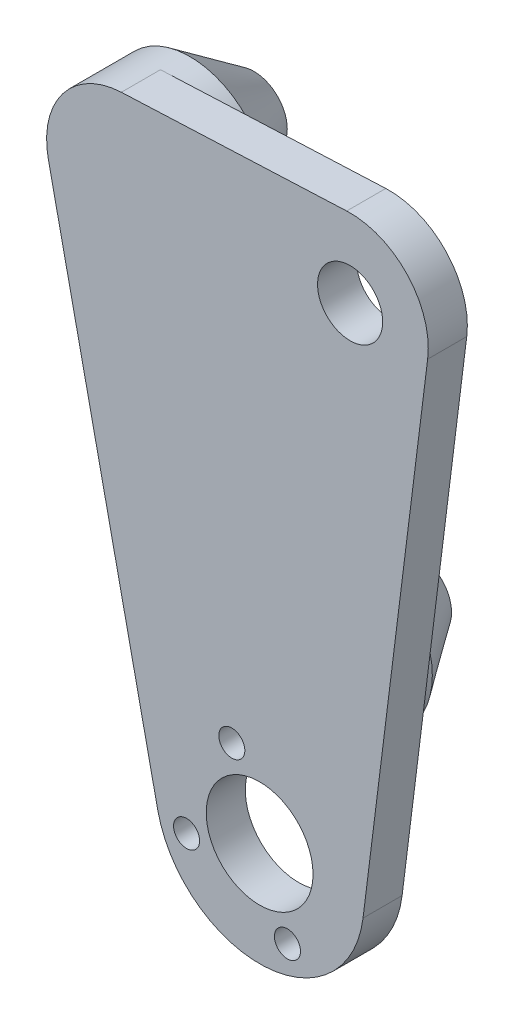
from build123d import *

# Parameters (mm, degrees)
BOSS_EXTRUDE1_DEPTH = 3
BOSS_EXTRUDE5_DEPTH = 3
SKETCH3_R           = 4.1
CUT_EXTRUDE1_DEPTH  = 50
BOSS_EXTRUDE2_START = -7
SKETCH1_3_R         = 6
BOSS_EXTRUDE2_DEPTH = 7
SKETCH1_4_R         = 6
BOSS_EXTRUDE3_DEPTH = 7
SKETCH1_5_R         = 6
BOSS_EXTRUDE6_DEPTH = 7
CHAMFER8_SIZE       = 5
CHAMFER8_SIZE_2     = 3.501037691
SKETCH9_R           = 1
CUT_EXTRUDE3_DEPTH  = 3
SKETCH13_R          = 2.5
CUT_EXTRUDE4_DEPTH  = 3


with BuildPart() as part:
    # Sketch1 → Boss-Extrude1 (new body)
    with BuildSketch(Plane.XY):
        with BuildLine():
            Line((8.47879639, 27.808299752), (-6.041521678, 42.809946731))
            ThreePointArc((-6.041521678, 42.809946731), (-13.178830457, 43.929795654), (-16.218713498, 37.375838886))
            Line((-16.218713498, 37.375838886), (-7.821268925, -1.68159222))
            ThreePointArc((-7.821268925, -1.68159222), (0.48240993, -7.985441795), (7.966824047, -0.727814955))
            Line((7.966824047, -0.727814955), (10.142674299, 23.089524856))
            ThreePointArc((10.142674299, 23.089524856), (9.826089659, 25.630630372), (8.47879639, 27.808299752))
        make_face()
    extrude(amount=BOSS_EXTRUDE1_DEPTH)

    # Sketch10 → Boss-Extrude5 (add)
    with BuildSketch(Plane.XY):
        with BuildLine():
            Line((-6.041521678, 42.809946731), (8.47879639, 27.808299752))
            ThreePointArc((8.47879639, 27.808299752), (9.826089659, 25.630630372), (10.142674299, 23.089524856))
            Line((10.142674299, 23.089524856), (7.966824047, -0.727814955))
            ThreePointArc((7.966824047, -0.727814955), (7.953555222, -0.86078995), (7.938067055, -0.993524752))
            Line((7.938067055, -0.993524752), (12.899477398, 38.647166557))
            ThreePointArc((12.899477398, 38.647166557), (11.356622336, 43.459959023), (6.684210782, 45.38659945))
            Line((6.684210782, 45.38659945), (-10.614478128, 44.631322381))
            ThreePointArc((-10.614478128, 44.631322381), (-8.13262373, 44.211168584), (-6.041521678, 42.809946731))
        make_face()
    extrude(amount=BOSS_EXTRUDE5_DEPTH)

    # Sketch3 → Cut-Extrude1 (cut)
    with BuildSketch(Plane.XY.offset(3)):
        Circle(SKETCH3_R)
    extrude(amount=-CUT_EXTRUDE1_DEPTH, mode=Mode.SUBTRACT)

    # Sketch1<3> → Boss-Extrude2 (add)
    with BuildSketch(Plane.XY.offset(BOSS_EXTRUDE2_START)):
        with Locations(Location((-10.352761804, 38.637033052, 0), (0, 0, 192.134016017))):
            Circle(SKETCH1_3_R)
    extrude(amount=BOSS_EXTRUDE2_DEPTH)

    # Sketch1<4> → Boss-Extrude3 (add)
    with BuildSketch(Plane.XY):
        with Locations((2.167556264, 25.701683368)):
            Circle(SKETCH1_4_R)
    extrude(amount=-BOSS_EXTRUDE3_DEPTH)

    # Sketch1<5> → Boss-Extrude6 (add)
    with BuildSketch(Plane.XY):
        with Locations((2.25742631, 12.802500789)):
            Circle(SKETCH1_5_R)
    extrude(amount=-BOSS_EXTRUDE6_DEPTH)

    # Sketch6 one side → Cut-Revolve1 (revolve, cut)
    with BuildSketch(Plane(origin=(-10.352761804, 0, 0), x_dir=(0, 0, -1), z_dir=(1, 0, 0))):
        with BuildLine():
            ThreePointArc((10, 34.637033052), (12.828427125, 35.808605927), (14, 38.637033052))
            ThreePointArc((14, 38.637033052), (12.828427125, 41.465460176), (10, 42.637033052))
            Line((10, 42.637033052), (10, 34.637033052))
        make_face()
    revolve(axis=Axis((-10.352761804, 42.637033052, -10), (0, -1, 0)), mode=Mode.SUBTRACT)

    # Sketch7 one side → Cut-Revolve2 (revolve, cut)
    with BuildSketch(Plane(origin=(2.167556264, 0, 0), x_dir=(0, 0, -1), z_dir=(1, 0, 0))):
        with BuildLine():
            ThreePointArc((10, 21.701683368), (12.828427125, 22.873256243), (14, 25.701683368))
            ThreePointArc((14, 25.701683368), (12.828427125, 28.530110493), (10, 29.701683368))
            Line((10, 29.701683368), (10, 21.701683368))
        make_face()
    revolve(axis=Axis((2.167556264, 29.701683368, -10), (0, -1, 0)), mode=Mode.SUBTRACT)

    # Sketch14 one side → Cut-Revolve3 (revolve, cut)
    with BuildSketch(Plane(origin=(2.25742631, 0, 0), x_dir=(0, 0, -1), z_dir=(1, 0, 0))):
        with BuildLine():
            ThreePointArc((10, 8.802500789), (12.828427125, 9.974073664), (14, 12.802500789))
            ThreePointArc((14, 12.802500789), (12.828427125, 15.630927914), (10, 16.802500789))
            Line((10, 16.802500789), (10, 8.802500789))
        make_face()
    revolve(axis=Axis((2.25742631, 16.802500789, -10), (0, -1, 0)), mode=Mode.SUBTRACT)

    # Chamfer8
    # the kernel refuses this chamfer: 5, 3.501037691 mm, written as the material it takes off along each edge
    with BuildSketch(Plane(origin=(-10.352761804, 38.637033052, -7), x_dir=(-0.9776586156884893, -0.21019902751931718, 0), z_dir=(-0.21019902751931718, 0.9776586156884893, 0))) as chamfer8_piece_1:
        Polygon((6, CHAMFER8_SIZE), (6 - CHAMFER8_SIZE_2, 0), (6, 0), align=None)
    revolve(axis=Axis((-10.352761804, 38.637033052, -7), (0, 0, 1)), mode=Mode.SUBTRACT)
    with BuildSketch(Plane(origin=(2.167556264, 25.701683368, -7), x_dir=(1, 0, 0), z_dir=(0, -1, 0))) as chamfer8_piece_2:
        Polygon((6, CHAMFER8_SIZE), (6 - CHAMFER8_SIZE_2, 0), (6, 0), align=None)
    revolve(axis=Axis((2.167556264, 25.701683368, -7), (0, 0, 1)), mode=Mode.SUBTRACT)
    with BuildSketch(Plane(origin=(2.25742631, 12.802500789, -7), x_dir=(1, 0, 0), z_dir=(0, -1, 0))) as chamfer8_piece_3:
        Polygon((6, CHAMFER8_SIZE), (6 - CHAMFER8_SIZE_2, 0), (6, 0), align=None)
    revolve(axis=Axis((2.25742631, 12.802500789, -7), (0, 0, 1)), mode=Mode.SUBTRACT)

    # Sketch9 → Cut-Extrude3 (cut)
    with BuildSketch(Plane.XY.offset(3)):
        with Locations((-2.135535698, 5.607092587)):
            Circle(SKETCH9_R)
        with Locations((2.135535698, -5.607092587)):
            Circle(SKETCH9_R)
        with Locations((-5.607092587, -2.135535698)):
            Circle(SKETCH9_R)
    extrude(amount=-CUT_EXTRUDE3_DEPTH, mode=Mode.SUBTRACT)

    # Sketch13 → Cut-Extrude4 (cut)
    with BuildSketch(Plane.XY.offset(3)):
        with Locations((6.945927107, 39.39231012)):
            Circle(SKETCH13_R)
    extrude(amount=-CUT_EXTRUDE4_DEPTH, mode=Mode.SUBTRACT)


solid = part.part
